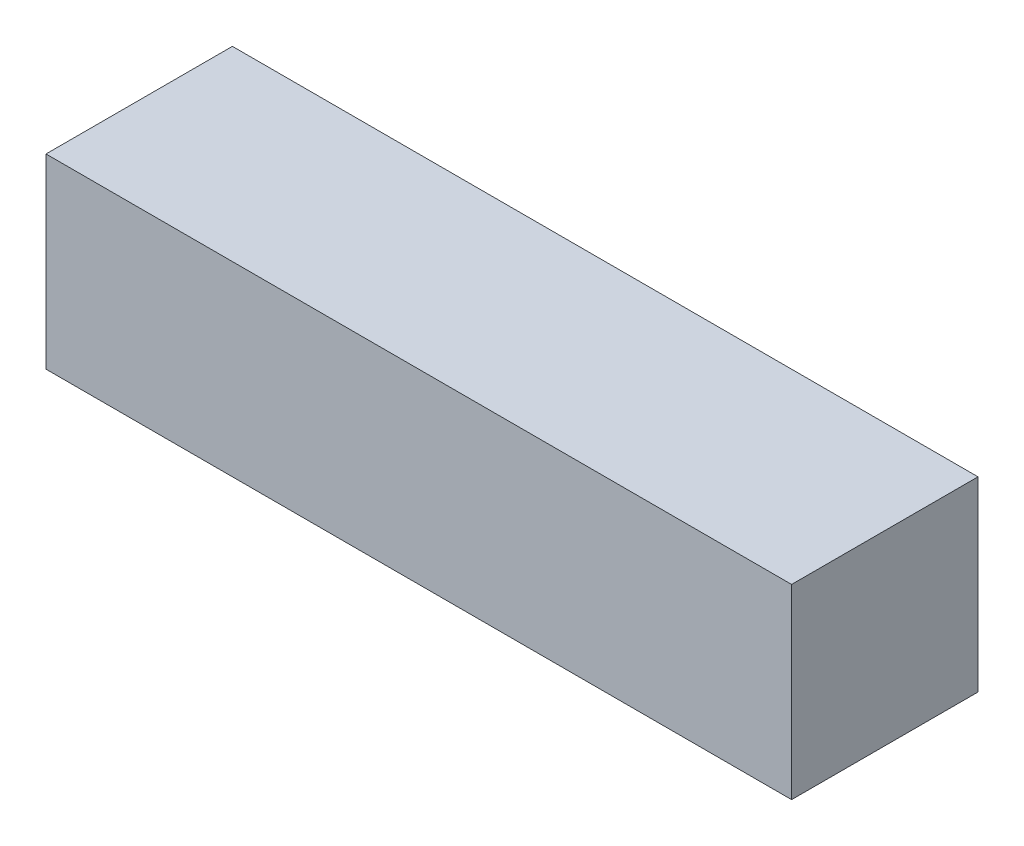
from build123d import *

# Parameters (mm, degrees)
SKETCH1_W           = 38.1
SKETCH1_H           = 9.525
BOSS_EXTRUDE1_DEPTH = 9.525


with BuildPart() as part:
    # Sketch1 → Boss-Extrude1 (new body)
    with BuildSketch(Plane.XY):
        Rectangle(SKETCH1_W, SKETCH1_H)
    extrude(amount=BOSS_EXTRUDE1_DEPTH)


solid = part.part
